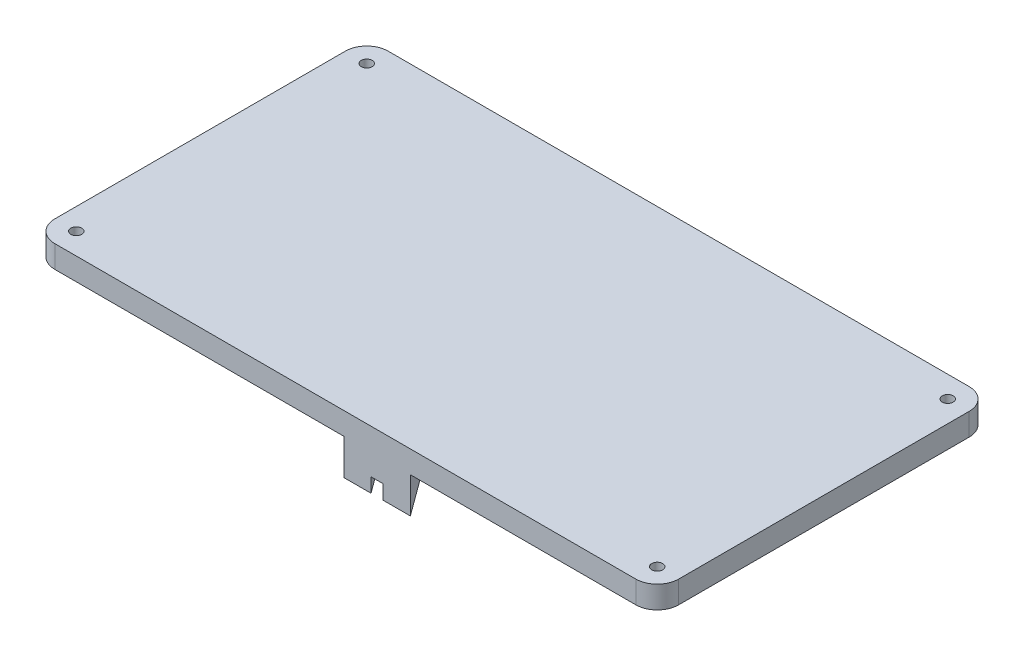
from build123d import *

# Parameters (mm, degrees)
EXTRUDE_1_DEPTH     = 5
EXTRUDE_2_DEPTH     = 13
EXTRUDE_3_DEPTH     = 10
EXTRUDE_4_DEPTH     = 7.28
EXTRUDE_5_DEPTH     = 9.8
SKETCH_2_23_R       = 1.225
CUT_EXTRUDE_1_DEPTH = 5


with BuildPart() as part:
    # 草图2 → 凸台-拉伸1 (new body)
    with BuildSketch(Plane(origin=(0, 0, 0), x_dir=(1, 0, 0), z_dir=(0, 1, 0))):
        with BuildLine():
            Line((69.8, -1.428456646), (69.8, -66.428456646))
            ThreePointArc((69.8, -66.428456646), (68.39411255, -69.822569196), (65, -71.228456646))
            Line((65, -71.228456646), (-65, -71.228456646))
            ThreePointArc((-65, -71.228456646), (-68.39411255, -69.822569196), (-69.8, -66.428456646))
            Line((-69.8, -66.428456646), (-69.8, -1.428456646))
            ThreePointArc((-69.8, -1.428456646), (-68.39411255, 1.965655904), (-65, 3.371543354))
            Line((-65, 3.371543354), (65, 3.371543354))
            ThreePointArc((65, 3.371543354), (68.39411255, 1.965655904), (69.8, -1.428456646))
        make_face()
    extrude(amount=-EXTRUDE_1_DEPTH)

    # 草图2<19> → 凸台-拉伸2 (add)
    with BuildSketch(Plane(origin=(0, 0, 0), x_dir=(1, 0, 0), z_dir=(0, 1, 0))):
        Polygon((14.518227689, -71.177974158), (-3.231616409, -46.992378558), (-10.358382401, -52.222722576), (-10.358382401, -57.563452802), (-0.32961603, -71.228456646), (5.748381901, -71.228456646), (-6.056399498, -55.143488942), (-4.282789154, -53.841833708), (7.668772538, -70.126801412), (8.477278931, -71.228456646), (14.555276861, -71.228456646), align=None)
    extrude(amount=-EXTRUDE_2_DEPTH)

    # 草图2<20> → 凸台-拉伸3 (add)
    with BuildSketch(Plane(origin=(0, 0, 0), x_dir=(1, 0, 0), z_dir=(0, 1, 0))):
        Polygon((57.842076132, -60.001030407), (39.164167684, -2.982298959), (23.293954098, -8.180983477), (41.971862546, -65.199714925), align=None)
        Polygon((29.475846356, -11.312150688), (36.033000472, -9.164191217), (51.660183874, -56.869863196), (45.103029757, -59.017822667), align=None, mode=Mode.SUBTRACT)
    extrude(amount=-EXTRUDE_3_DEPTH)

    # 草图2<21> → 凸台-拉伸4 (add)
    with BuildSketch(Plane(origin=(0, 0, 0), x_dir=(1, 0, 0), z_dir=(0, 1, 0))):
        Polygon((51.660183874, -56.869863196), (36.033000472, -9.164191217), (29.475846356, -11.312150688), (45.103029757, -59.017822667), align=None)
    extrude(amount=-EXTRUDE_4_DEPTH)

    # 草图2<22> → 凸台-拉伸5 (add)
    with BuildSketch(Plane(origin=(0, 0, 0), x_dir=(1, 0, 0), z_dir=(0, 1, 0))):
        Polygon((5.748381901, -71.228456646), (8.477278931, -71.228456646), (7.668772538, -70.126801412), (-4.282789154, -53.841833708), (-6.056399498, -55.143488942), align=None)
    extrude(amount=-EXTRUDE_5_DEPTH)

    # 草图2<23> → 切除-拉伸1 (cut)
    with BuildSketch(Plane(origin=(0, 0, 0), x_dir=(1, 0, 0), z_dir=(0, 1, 0))):
        with Locations((-65, -1.428456646)):
            Circle(SKETCH_2_23_R)
        with Locations((-65, -66.428456646)):
            Circle(SKETCH_2_23_R)
        with Locations((65, -66.428456646)):
            Circle(SKETCH_2_23_R)
        with Locations((65, -1.428456646)):
            Circle(SKETCH_2_23_R)
    extrude(amount=-CUT_EXTRUDE_1_DEPTH, mode=Mode.SUBTRACT)


solid = part.part
